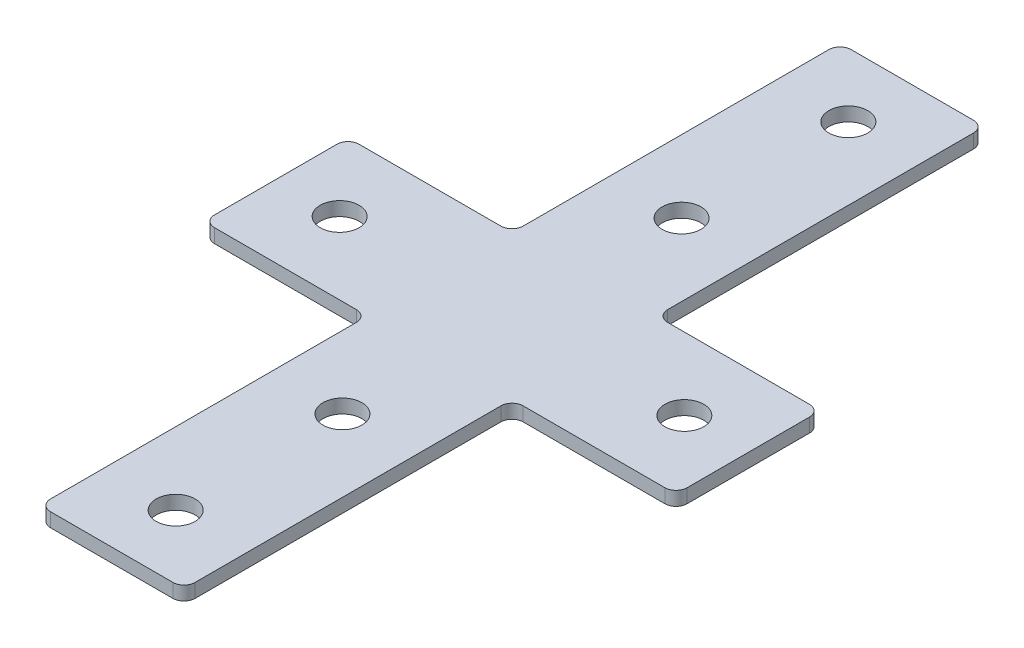
from build123d import *

# Parameters (mm, degrees)
SKETCH_1_R      = 3.5
EXTRUDE_1_DEPTH = 2.5
FILLET_1_R      = 2


with BuildPart() as part:
    # 草图1 → 凸台-拉伸1 (new body)
    with BuildSketch(Plane(origin=(0, 0, 0), x_dir=(1, 0, 0), z_dir=(0, 1, 0))):
        Polygon((-13, 72), (13, 72), (13, 13), (42.5, 13), (42.5, -13), (13, -13), (13, -72), (-13, -72), (-13, -13), (-42.5, -13), (-42.5, 13), (-13, 13), align=None)
        with Locations((0, -60.5)):
            Circle(SKETCH_1_R, mode=Mode.SUBTRACT)
        with Locations((0, -30.5)):
            Circle(SKETCH_1_R, mode=Mode.SUBTRACT)
        with Locations((-31, 0)):
            Circle(SKETCH_1_R, mode=Mode.SUBTRACT)
        with Locations((31, 0)):
            Circle(SKETCH_1_R, mode=Mode.SUBTRACT)
        with Locations((0, 60.5)):
            Circle(SKETCH_1_R, mode=Mode.SUBTRACT)
        with Locations((0, 30.5)):
            Circle(SKETCH_1_R, mode=Mode.SUBTRACT)
    extrude(amount=EXTRUDE_1_DEPTH)

    # 圆角1
    fillet_1_edges = [part.edges().sort_by_distance(p)[0] for p in [
        (-13, 1.25, 13),
        (13, 1.25, 13),
        (13, 1.25, -13),
        (-13, 1.25, -13),
        (-42.5, 1.25, -13),
        (-42.5, 1.25, 13),
        (-13, 1.25, 72),
        (13, 1.25, 72),
        (42.5, 1.25, 13),
        (42.5, 1.25, -13),
        (13, 1.25, -72),
        (-13, 1.25, -72),
    ]]
    fillet(fillet_1_edges, radius=FILLET_1_R)


solid = part.part
